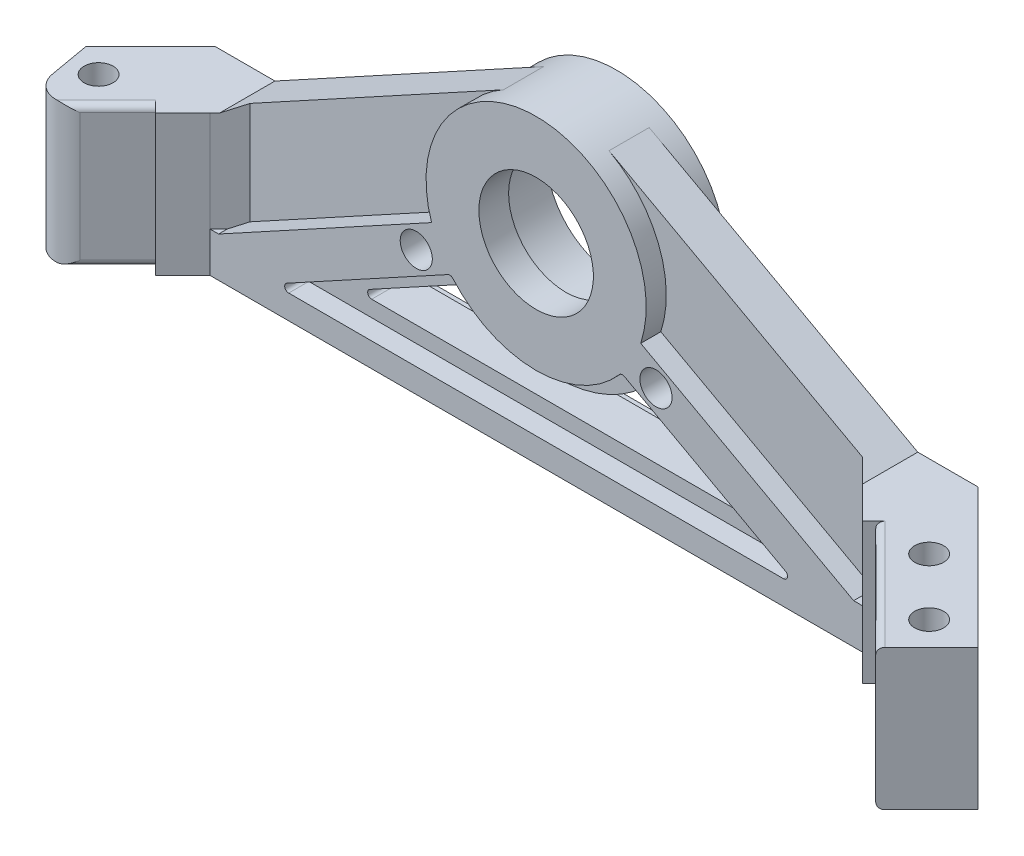
from build123d import *

# Parameters (mm, degrees)
BOSS_EXTRUDE1_DEPTH     = 11.1125
BOSS_EXTRUDE2_DEPTH     = 12.7
CUT_EXTRUDE2_DEPTH      = 8
CUT_EXTRUDE3_DEPTH      = 96.942967533
SKETCH5_W               = 25.144717139
SKETCH5_H               = 15.875
CUT_EXTRUDE4_DEPTH      = 3.175
CUT_EXTRUDE5_DEPTH      = 96.942967533
SKETCH6_R               = 2.54
CUT_EXTRUDE6_DEPTH      = 96.942967533
CUT_EXTRUDE7_START      = -3.175
CUT_EXTRUDE7_DEPTH      = 3.175
CHAMFER1_SIZE           = 3.175
FILLET1_R               = 0.635
FILLET3_R               = 1.016
SKETCH8_R               = 2.286
CUT_EXTRUDE8_DEPTH      = 93.295392221
CUT_EXTRUDE9_DEPTH      = 93.295392221
CUT_EXTRUDE9_DEPTH_BACK = 93.295392221
FILLET4_R               = 3.81
CUT_EXTRUDE10_DEPTH     = 0.5


# Some blends are built 0.0001 mm under size
with BuildPart() as part:
    # Sketch3 → Boss-Extrude1 (new, symmetric)
    with BuildSketch(Plane(origin=(0, 0, 0), x_dir=(1, 0, 0), z_dir=(0, 1, 0))):
        Polygon((-56.934473853, -15.948934871), (-65.016704362, -7.866704362), (-82.294717139, -25.144717139), (-74.93090712, -32.508527158), (-74.21248663, -33.226947648), align=None)
        Polygon((-65.016704362, -7.866704362), (-55.873813681, -17.009595043), (-52.371513794, -13.507295156), (-61.514404475, -4.364404475), align=None)
        Polygon((-52.371513794, -13.507295156), (-51.564218639, -12.7), (-17.311249955, -12.7), (0, -12.7), (0, 0), (-17.311249955, 0), (-57.15, 0), (-60.325, -3.175), (-61.514404475, -4.364404475), align=None)
        Polygon((0, 0), (0, -12.7), (17.311249955, -12.7), (51.564218639, -12.7), (52.371513794, -13.507295156), (61.514404475, -4.364404475), (60.325, -3.175), (57.15, 0), (17.311249955, 0), align=None)
        Polygon((61.514404475, -4.364404475), (65.016704362, -7.866704362), (55.873813681, -17.009595043), (52.371513794, -13.507295156), align=None)
        Polygon((65.016704362, -7.866704362), (56.934473853, -15.948934871), (74.21248663, -33.226947648), (74.93090712, -32.508527158), (82.294717139, -25.144717139), align=None)
    extrude(amount=BOSS_EXTRUDE1_DEPTH, both=True)

    # Sketch2 → Boss-Extrude2 (add)
    with BuildSketch(Plane.XY):
        with BuildLine():
            Line((-50.804788276, 11.1125), (50.804788276, 11.1125))
            Line((50.804788276, 11.1125), (8.344749207, 34.318436746))
            ThreePointArc((8.344749207, 34.318436746), (0, 36.45), (-8.344749207, 34.318436746))
            Line((-8.344749207, 34.318436746), (-50.804788276, 11.1125))
        make_face()
    extrude(amount=BOSS_EXTRUDE2_DEPTH)

    # Sketch2<3> → Cut-Extrude2 (cut)
    with BuildSketch(Plane.XY):
        with BuildLine():
            ThreePointArc((0, 30.1), (-11.05, 19.05), (0, 8))
            Line((0, 8), (0, 10))
            ThreePointArc((0, 10), (-9.05, 19.05), (0, 28.1))
            Line((0, 28.1), (0, 30.1))
        make_face()
        with BuildLine():
            Line((0, 10), (0, 8))
            ThreePointArc((0, 8), (7.813529932, 11.236470068), (11.05, 19.05))
            ThreePointArc((11.05, 19.05), (7.813529932, 26.863529932), (0, 30.1))
            Line((0, 30.1), (0, 28.1))
            ThreePointArc((0, 28.1), (6.39931637, 25.44931637), (9.05, 19.05))
            ThreePointArc((9.05, 19.05), (6.39931637, 12.65068363), (0, 10))
        make_face()
        with BuildLine():
            ThreePointArc((0, 28.1), (-9.05, 19.05), (0, 10))
            Line((0, 10), (0, 28.1))
        make_face()
        with BuildLine():
            Line((0, 28.1), (0, 10))
            ThreePointArc((0, 10), (6.39931637, 12.65068363), (9.05, 19.05))
            ThreePointArc((9.05, 19.05), (6.39931637, 25.44931637), (0, 28.1))
        make_face()
    extrude(amount=CUT_EXTRUDE2_DEPTH, mode=Mode.SUBTRACT)

    # Sketch2<5> → Cut-Extrude3 (cut, through all)
    with BuildSketch(Plane.XY):
        with BuildLine():
            ThreePointArc((0, 28.1), (-9.05, 19.05), (0, 10))
            Line((0, 10), (0, 28.1))
        make_face()
        with BuildLine():
            Line((0, 28.1), (0, 10))
            ThreePointArc((0, 10), (6.39931637, 12.65068363), (9.05, 19.05))
            ThreePointArc((9.05, 19.05), (6.39931637, 25.44931637), (0, 28.1))
        make_face()
    extrude(amount=CUT_EXTRUDE3_DEPTH, mode=Mode.SUBTRACT)

    # Sketch5 → Cut-Extrude4 (cut)
    # profile 1 of 5: a face of its own
    with BuildSketch(Plane(origin=(0, 0, 0), x_dir=(-1, 0, 0), z_dir=(0, 0, -1))):
        with Locations((-69.72235857, 3.175)):
            Rectangle(SKETCH5_W, SKETCH5_H)
    # profile 2 of 5: a face of its own
    with BuildSketch(Plane(origin=(0, 0, 0), x_dir=(-1, 0, 0), z_dir=(0, 0, -1))):
        with BuildLine():
            Line((-50.190202202, -4.7625), (-16.534774751, 13.631400187))
            ThreePointArc((-16.534774751, 13.631400187), (-16.178258512, 25.454994263), (-8.344749207, 34.318436746))
            Line((-8.344749207, 34.318436746), (-50.804788276, 11.1125))
            Line((-50.804788276, 11.1125), (-57.15, 11.1125))
            Line((-57.15, 11.1125), (-57.15, -4.7625))
            Line((-57.15, -4.7625), (-50.190202202, -4.7625))
        make_face()
    # profile 3 of 5: a face of its own
    with BuildSketch(Plane(origin=(0, 0, 0), x_dir=(-1, 0, 0), z_dir=(0, 0, -1))):
        with BuildLine():
            Line((50.804788276, 11.1125), (8.344749207, 34.318436746))
            ThreePointArc((8.344749207, 34.318436746), (14.965938597, 27.925848236), (17.4, 19.05))
            ThreePointArc((17.4, 19.05), (17.182332215, 16.306378367), (16.534774751, 13.631400187))
            Line((16.534774751, 13.631400187), (50.190202202, -4.7625))
            Line((50.190202202, -4.7625), (57.15, -4.7625))
            Line((57.15, -4.7625), (57.15, 11.1125))
            Line((57.15, 11.1125), (50.804788276, 11.1125))
        make_face()
    # profile 4 of 5: a face of its own
    with BuildSketch(Plane(origin=(0, 0, 0), x_dir=(-1, 0, 0), z_dir=(0, 0, -1))):
        with Locations((69.72235857, 3.175)):
            Rectangle(SKETCH5_W, SKETCH5_H)
    # profile 5 of 5: a face of its own
    with BuildSketch(Plane(origin=(0, 0, 0), x_dir=(-1, 0, 0), z_dir=(0, 0, -1))):
        with BuildLine():
            ThreePointArc((13.489420874, 8.059298271), (0, 1.65), (-13.489420874, 8.059298271))
            Line((-13.489420874, 8.059298271), (-41.5969936, -7.3025))
            Line((-41.5969936, -7.3025), (41.5969936, -7.3025))
            Line((41.5969936, -7.3025), (13.489420874, 8.059298271))
        make_face()
        with BuildLine():
            Line((31.653276027, -4.7625), (-31.653276027, -4.7625))
            Line((-31.653276027, -4.7625), (-14.022402602, 4.873405723))
            ThreePointArc((-14.022402602, 4.873405723), (0, -0.89), (14.022402602, 4.873405723))
            Line((14.022402602, 4.873405723), (31.653276027, -4.7625))
        make_face(mode=Mode.SUBTRACT)
    extrude(amount=-CUT_EXTRUDE4_DEPTH, mode=Mode.SUBTRACT)

    # Sketch5<3> → Cut-Extrude5 (cut, through all)
    with BuildSketch(Plane(origin=(0, 0, 0), x_dir=(-1, 0, 0), z_dir=(0, 0, -1))):
        with BuildLine():
            ThreePointArc((-14.022402602, 4.873405723), (0, -0.89), (14.022402602, 4.873405723))
            Line((14.022402602, 4.873405723), (31.653276027, -4.7625))
            Line((31.653276027, -4.7625), (-31.653276027, -4.7625))
            Line((-31.653276027, -4.7625), (-14.022402602, 4.873405723))
        make_face()
    extrude(amount=-CUT_EXTRUDE5_DEPTH, mode=Mode.SUBTRACT)

    # Sketch6 → Cut-Extrude6 (cut, through all)
    with BuildSketch(Plane(origin=(0, 0, 0), x_dir=(-1, 0, 0), z_dir=(0, 0, -1))):
        with Locations((-18.945146514, 8.695796817)):
            Circle(SKETCH6_R)
        with Locations((18.945146514, 8.695796817)):
            Circle(SKETCH6_R)
    extrude(amount=-CUT_EXTRUDE6_DEPTH, mode=Mode.SUBTRACT)

    # Sketch7 → Cut-Extrude7 (cut)
    # profile 1 of 3: a face of its own
    with BuildSketch(Plane.XY.offset(12.7).offset(CUT_EXTRUDE7_START)):
        with BuildLine():
            ThreePointArc((13.489420874, 8.059298271), (0, 1.65), (-13.489420874, 8.059298271))
            Line((-13.489420874, 8.059298271), (-41.5969936, -7.3025))
            Line((-41.5969936, -7.3025), (41.5969936, -7.3025))
            Line((41.5969936, -7.3025), (13.489420874, 8.059298271))
        make_face()
        with BuildLine():
            Line((-31.653276027, -4.7625), (-14.022402602, 4.873405723))
            ThreePointArc((-14.022402602, 4.873405723), (0, -0.89), (14.022402602, 4.873405723))
            Line((14.022402602, 4.873405723), (31.653276027, -4.7625))
            Line((31.653276027, -4.7625), (-31.653276027, -4.7625))
        make_face(mode=Mode.SUBTRACT)
    # profile 2 of 3: a face of its own
    with BuildSketch(Plane.XY.offset(12.7).offset(CUT_EXTRUDE7_START)):
        with BuildLine():
            Line((-51.564218639, -4.7625), (-50.190202202, -4.7625))
            Line((-50.190202202, -4.7625), (-16.534774751, 13.631400187))
            ThreePointArc((-16.534774751, 13.631400187), (-16.178258512, 25.454994263), (-8.344749207, 34.318436746))
            Line((-8.344749207, 34.318436746), (-50.804788276, 11.1125))
            Line((-50.804788276, 11.1125), (-51.564218639, 11.1125))
            Line((-51.564218639, 11.1125), (-51.564218639, -4.7625))
        make_face()
    # profile 3 of 3: a face of its own
    with BuildSketch(Plane.XY.offset(12.7).offset(CUT_EXTRUDE7_START)):
        with BuildLine():
            Line((50.804788276, 11.1125), (8.344749207, 34.318436746))
            ThreePointArc((8.344749207, 34.318436746), (14.965938597, 27.925848236), (17.4, 19.05))
            ThreePointArc((17.4, 19.05), (17.182332215, 16.306378367), (16.534774751, 13.631400187))
            Line((16.534774751, 13.631400187), (50.190202202, -4.7625))
            Line((50.190202202, -4.7625), (51.564218639, -4.7625))
            Line((51.564218639, -4.7625), (51.564218639, 11.1125))
            Line((51.564218639, 11.1125), (50.804788276, 11.1125))
        make_face()
    extrude(amount=CUT_EXTRUDE7_DEPTH, mode=Mode.SUBTRACT)

    # Chamfer1
    chamfer1_edges = [part.edges().sort_by_distance(p)[0] for p in [
        (51.564218639, 3.175, 9.525),
        (-51.564218639, 3.175, 9.525),
    ]]
    chamfer(chamfer1_edges, length=CHAMFER1_SIZE - 0.0001)  # a hair under: the kernel refuses the full size

    # Fillet1
    fillet1_edges = [part.edges().sort_by_distance(p)[0] for p in [
        (13.489420874, 8.059298271, 1.5875),
        (-13.489420874, 8.059298271, 1.5875),
        (-41.5969936, -7.3025, 1.5875),
        (41.5969936, -7.3025, 1.5875),
        (14.022402602, 4.873405723, 6.35),
        (31.653276027, -4.7625, 6.35),
        (-31.653276027, -4.7625, 6.35),
        (-14.022402602, 4.873405723, 6.35),
        (-13.489420874, 8.059298271, 11.1125),
        (13.489420874, 8.059298271, 11.1125),
        (41.5969936, -7.3025, 11.1125),
        (-41.5969936, -7.3025, 11.1125),
    ]]
    fillet(fillet1_edges, radius=FILLET1_R)

    # Fillet3
    fillet3_edges = [part.edges().sort_by_distance(p)[0] for p in [
        (65.573480242, -11.1125, 24.587941259),
        (-65.573480242, -11.1125, 24.587941259),
        (65.573480242, 11.1125, 24.587941259),
        (-65.573480242, 11.1125, 24.587941259),
    ]]
    fillet(fillet3_edges, radius=FILLET3_R)

    # Sketch8 → Cut-Extrude8 (cut, through all)
    with BuildSketch(Plane(origin=(0, 11.1125, 0), x_dir=(1, 0, 0), z_dir=(0, 1, 0))):
        with Locations(Location((74.625578412, -25.198598676, 0), (0, 0, 270))):
            Circle(SKETCH8_R)
        with Locations(Location((-74.625578412, -25.198598676, 0), (0, 0, 270))):
            Circle(SKETCH8_R)
        with Locations(Location((65.645322291, -16.218342555, 0), (0, 0, 270))):
            Circle(SKETCH8_R)
        with Locations(Location((-65.645322291, -16.218342555, 0), (0, 0, 90))):
            Circle(SKETCH8_R)
    extrude(amount=-CUT_EXTRUDE8_DEPTH, mode=Mode.SUBTRACT)

    # Sketch9 → Cut-Extrude9 (cut, two sides: drawn at the far end of the back side and taken through both)
    with BuildSketch(Plane(origin=(0, 11.1125, 0), x_dir=(1, 0, 0), z_dir=(0, 1, 0)).offset(-CUT_EXTRUDE9_DEPTH_BACK)):
        Polygon((-87.387144721, -37.100830404), (-87.387144721, -13.335), (-70.485, -13.335), (-68.277385266, -25.855005305), (-66.294442881, -37.100830404), align=None)
    extrude(amount=CUT_EXTRUDE9_DEPTH + CUT_EXTRUDE9_DEPTH_BACK, mode=Mode.SUBTRACT)

    # Fillet4
    # the kernel refuses this fillet: 3.81 mm, written as the material it takes off along each edge
    with BuildSketch(Plane(origin=(-68.062008219, -28.393854759, 27.076469237), x_dir=(-0.17364817766692658, 0, -0.9848077530122087), z_dir=(0, 1, 0))) as fillet4_piece_1:
        with BuildLine():
            CenterArc((FILLET4_R * 1.92098212697, -FILLET4_R), FILLET4_R, 90, 125)
            Line((FILLET4_R * 1.10183008268, -FILLET4_R * 1.57357643635), (0, 0))
            Line((0, 0), (FILLET4_R * 1.92098212697, 0))
        make_face()
    extrude(amount=56.787709519, mode=Mode.SUBTRACT)

    # Sketch11 → Cut-Extrude10 (cut)
    # profile 1 of 5: a face of its own
    with BuildSketch(Plane.XZ.offset(11.1125)):
        with BuildLine():
            Line((6.955128205, 5.655889423), (6.573717949, 5.452564103))
            add(Edge.make_bspline(
                [(6.573717949, 5.452564103), (6.545922437, 5.498605223), (6.492797515, 5.586602559), (6.405563696, 5.705145418), (6.318829653, 5.806231322), (6.231739217, 5.889758205), (6.143082637, 5.95438438), (6.053764997, 6.001091066), (5.963227276, 6.030447771), (5.9020118, 6.034100411), (5.871895032, 6.035897436)],
                knots=[0, 0, 0, 0, 1.354943589, 2.589672558, 3.704607527, 4.708856974, 5.624398268, 6.459549776, 7.242129862, 8, 8, 8, 8], degree=3))
            add(Edge.make_bspline(
                [(5.871895032, 6.035897436), (5.843777409, 6.034998249), (5.788084486, 6.03321722), (5.706289617, 6.017626176), (5.626860085, 5.99419681), (5.551935483, 5.959511514), (5.48244247, 5.918382044), (5.420674582, 5.869797955), (5.368082166, 5.814645054), (5.325239521, 5.753088186), (5.291507213, 5.688001962), (5.267412618, 5.620080583), (5.252956595, 5.549928839), (5.250989532, 5.502409986), (5.25, 5.478505609)],
                knots=[0, 0, 0, 0, 1.088711937, 2.156425153, 3.216543554, 4.290691142, 5.346933412, 6.339926723, 7.326538423, 8.288906172, 9.236802047, 10.159214894, 11.073992371, 12, 12, 12, 12], degree=3))
            add(Edge.make_bspline(
                [(5.25, 5.478505609), (5.251289441, 5.451237129), (5.253897944, 5.396073728), (5.277544855, 5.314729095), (5.312451573, 5.233254329), (5.346112616, 5.182849411), (5.363581731, 5.156690705)],
                knots=[0, 0, 0, 0, 0.942144539, 1.905933023, 2.913239343, 4, 4, 4, 4], degree=3))
            add(Edge.make_bspline(
                [(5.363581731, 5.156690705), (5.378599068, 5.137617448), (5.410211837, 5.097466622), (5.463771743, 5.037071303), (5.526108213, 4.973940726), (5.598480894, 4.909395911), (5.677065406, 4.839348386), (5.765885722, 4.768357575), (5.862751255, 4.693916401), (5.930689868, 4.644038805), (5.965845353, 4.618229167)],
                knots=[0, 0, 0, 0, 0.718605451, 1.5127255, 2.388525841, 3.34361075, 4.383114545, 5.504804886, 6.708837455, 8, 8, 8, 8], degree=3))
            add(Edge.make_bspline(
                [(5.965845353, 4.618229167), (6.00168954, 4.592171602), (6.070464497, 4.542174431), (6.167362407, 4.468878347), (6.254240814, 4.401295296), (6.3304335, 4.339372455), (6.395949126, 4.282571618), (6.450649678, 4.231125865), (6.496181868, 4.186447001), (6.520649569, 4.156384964), (6.531650641, 4.14286859)],
                knots=[0, 0, 0, 0, 1.435833971, 2.754963323, 3.936484598, 5.002077172, 5.935979083, 6.744956812, 7.435712417, 8, 8, 8, 8], degree=3))
            add(Edge.make_bspline(
                [(6.531650641, 4.14286859), (6.547710719, 4.122117406), (6.579262034, 4.081350037), (6.61920709, 4.015956536), (6.653578917, 3.949707187), (6.681889214, 3.881988561), (6.703827988, 3.813016997), (6.718920828, 3.742550617), (6.729567054, 3.670869327), (6.730367062, 3.622441786), (6.730769231, 3.598096955)],
                knots=[0, 0, 0, 0, 1.064105702, 2.090521257, 3.104283852, 4.09061442, 5.065433238, 6.036507983, 7.012940167, 8, 8, 8, 8], degree=3))
            add(Edge.make_bspline(
                [(6.730769231, 3.598096955), (6.729515083, 3.560126606), (6.727031963, 3.484948093), (6.704399939, 3.375068313), (6.668607851, 3.26994227), (6.617838539, 3.171328353), (6.554959306, 3.080088965), (6.479870762, 2.998403207), (6.392434284, 2.927813249), (6.294689139, 2.868139824), (6.189328785, 2.819749269), (6.078360338, 2.785257467), (5.963128198, 2.764347606), (5.884835503, 2.761630248), (5.845252404, 2.76025641)],
                knots=[0, 0, 0, 0, 1.004538361, 1.98891246, 2.957754601, 3.937604432, 4.916182936, 5.884154884, 6.865254872, 7.882148152, 8.909646262, 9.927556077, 10.952217026, 12, 12, 12, 12], degree=3))
            add(Edge.make_bspline(
                [(5.845252404, 2.76025641), (5.800288489, 2.761765646), (5.711198198, 2.764756006), (5.58029896, 2.787799883), (5.45446477, 2.825234465), (5.353568286, 2.868466228), (5.275055104, 2.912290321), (5.215686682, 2.951924562), (5.154833361, 2.996764375), (5.09442727, 3.049062555), (5.032112714, 3.106283691), (4.9710811, 3.171539686), (4.907469941, 3.241090211), (4.86692652, 3.291248304), (4.846153846, 3.316947115)],
                knots=[0, 0, 0, 0, 1.360687177, 2.696028959, 4.010076158, 5.328383209, 6.009416266, 6.72960499, 7.488083515, 8.296188009, 9.147227534, 10.04798982, 10.999875445, 12, 12, 12, 12], degree=3))
            Line((4.846153846, 3.316947115), (5.212139423, 3.567948718))
            add(Edge.make_bspline(
                [(5.212139423, 3.567948718), (5.231197788, 3.547515179), (5.267953877, 3.508106922), (5.322642771, 3.45291865), (5.373784064, 3.403079657), (5.421450494, 3.358595495), (5.466336542, 3.319984295), (5.508000192, 3.286910753), (5.546973362, 3.260282729), (5.593160244, 3.230943128), (5.651920246, 3.204105222), (5.723895671, 3.180794058), (5.798937681, 3.16714817), (5.849638961, 3.165128681), (5.875400641, 3.164102564)],
                knots=[0, 0, 0, 0, 1.253255604, 2.417037033, 3.484535688, 4.456276324, 5.340879413, 6.139846054, 6.840628373, 7.457335203, 8.592193832, 9.725986821, 10.844557802, 12, 12, 12, 12], degree=3))
            add(Edge.make_bspline(
                [(5.875400641, 3.164102564), (5.902885124, 3.165396572), (5.956317203, 3.167912228), (6.032932005, 3.189110321), (6.103119698, 3.223200893), (6.165194449, 3.27097975), (6.217718177, 3.329639699), (6.255574284, 3.399162998), (6.277829561, 3.478036176), (6.280604327, 3.533445496), (6.282051282, 3.562339744)],
                knots=[0, 0, 0, 0, 1.033786987, 2.00976631, 2.970458119, 3.95651055, 4.942051941, 5.915168215, 6.91282465, 8, 8, 8, 8], degree=3))
            add(Edge.make_bspline(
                [(6.282051282, 3.562339744), (6.28149088, 3.581062134), (6.28037143, 3.618461629), (6.272009308, 3.67382967), (6.256922644, 3.72753238), (6.23645815, 3.780017787), (6.209395004, 3.831703254), (6.175597302, 3.882906129), (6.134357789, 3.933943781), (6.102846717, 3.966210779), (6.086438301, 3.983012821)],
                knots=[0, 0, 0, 0, 0.941102048, 1.879927795, 2.806320176, 3.740133313, 4.70706341, 5.733547381, 6.819814909, 8, 8, 8, 8], degree=3))
            add(Edge.make_bspline(
                [(6.086438301, 3.983012821), (6.078121626, 3.990836739), (6.059033112, 4.008794272), (6.024022728, 4.036292581), (5.981368032, 4.070768116), (5.930477678, 4.111658174), (5.869678278, 4.156742774), (5.801217798, 4.209033937), (5.723362816, 4.266177574), (5.668576046, 4.306239142), (5.639823718, 4.327263622)],
                knots=[0, 0, 0, 0, 0.485581606, 1.114511607, 1.892484918, 2.819534315, 3.891398566, 5.11240712, 6.484579029, 8, 8, 8, 8], degree=3))
            add(Edge.make_bspline(
                [(5.639823718, 4.327263622), (5.600647247, 4.355810699), (5.524859001, 4.411036014), (5.417274927, 4.494420765), (5.320111394, 4.575739513), (5.231859623, 4.653699656), (5.153297125, 4.728862304), (5.085159515, 4.802258672), (5.025718972, 4.871778844), (4.962356185, 4.960505052), (4.898616052, 5.06962878), (4.843298524, 5.202280536), (4.808089766, 5.335069751), (4.80353079, 5.424082684), (4.801282051, 5.467988782)],
                knots=[0, 0, 0, 0, 1.186639563, 2.29559556, 3.331401308, 4.287832086, 5.178002532, 5.991653193, 6.738845359, 7.415240842, 8.658551622, 9.823054859, 10.926210341, 12, 12, 12, 12], degree=3))
            add(Edge.make_bspline(
                [(4.801282051, 5.467988782), (4.802275506, 5.499122385), (4.804250073, 5.561002801), (4.818566607, 5.652496737), (4.842387021, 5.741426577), (4.876660762, 5.827412615), (4.919396348, 5.91127786), (4.972439298, 5.992227342), (5.035257903, 6.070059394), (5.106262482, 6.144446648), (5.183899032, 6.213576047), (5.267788427, 6.274099775), (5.356348148, 6.325831589), (5.450294329, 6.366808857), (5.548106527, 6.400426022), (5.651087312, 6.423387681), (5.758665045, 6.436656939), (5.831894176, 6.438703864), (5.869090545, 6.43974359)],
                knots=[0, 0, 0, 0, 0.932738639, 1.853889356, 2.767877299, 3.686041414, 4.622558463, 5.584089528, 6.580490983, 7.61578374, 8.662665956, 9.690923261, 10.710750907, 11.729736566, 12.757349726, 13.805636525, 14.885384091, 16, 16, 16, 16], degree=3))
            add(Edge.make_bspline(
                [(5.869090545, 6.43974359), (5.896214412, 6.439141134), (5.949637214, 6.437954545), (6.028947511, 6.430427802), (6.106126309, 6.415961477), (6.181596753, 6.397257975), (6.255405946, 6.373441591), (6.326602693, 6.34297607), (6.396372582, 6.307982208), (6.464315382, 6.267008021), (6.530517733, 6.219030474), (6.595355852, 6.163337979), (6.658453112, 6.09895153), (6.720891134, 6.026707642), (6.781845028, 5.945793723), (6.841172492, 5.856635242), (6.899631031, 5.759519711), (6.936264526, 5.691113712), (6.955128205, 5.655889423)],
                knots=[0, 0, 0, 0, 0.916943493, 1.805999526, 2.689245248, 3.568702553, 4.433092864, 5.307568578, 6.183755457, 7.069823058, 7.986358083, 8.944343836, 9.955449961, 11.030835633, 12.170024038, 13.377301724, 14.649494474, 16, 16, 16, 16], degree=3))
        make_face()
    # profile 2 of 5: a face of its own
    with BuildSketch(Plane.XZ.offset(11.1125)):
        Polygon((4.128205128, 6.35), (4.128205128, 2.85), (3.962039263, 2.85), (1.83974359, 5.509354968), (1.83974359, 2.85), (1.391025641, 2.85), (1.391025641, 6.35), (1.574719551, 6.35), (3.679487179, 3.69765625), (3.679487179, 6.35), align=None)
    # profile 3 of 5: a face of its own
    with BuildSketch(Plane.XZ.offset(11.1125)):
        Polygon((0.043469551, 2.85), (-0.717948718, 2.85), (-0.717948718, 6.35), (-0.269230769, 6.35), (-0.269230769, 3.253846154), (0.269230769, 3.253846154), align=None)
    # profile 4 of 5: a face of its own
    with BuildSketch(Plane.XZ.offset(11.1125)):
        with BuildLine():
            add(Edge.make_bspline(
                [(-1.929487179, 4.601402244), (-1.929820024, 4.545772786), (-1.930466421, 4.437738209), (-1.937473576, 4.280579568), (-1.949475503, 4.133047998), (-1.965186437, 3.99497525), (-1.985981936, 3.866455085), (-2.01210377, 3.747657913), (-2.041666608, 3.638070524), (-2.077057072, 3.537721733), (-2.116884293, 3.445335588), (-2.159279173, 3.358445926), (-2.207248145, 3.277982304), (-2.258445983, 3.202763868), (-2.313138476, 3.132633266), (-2.372968524, 3.069102006), (-2.436199286, 3.01043296), (-2.503346552, 2.957979374), (-2.573759685, 2.911897493), (-2.645716894, 2.870677498), (-2.720506077, 2.837466064), (-2.796608784, 2.808773511), (-2.875043288, 2.787234356), (-2.955710335, 2.771953379), (-3.038153153, 2.761483068), (-3.094018037, 2.760666707), (-3.122095353, 2.76025641)],
                knots=[0, 0, 0, 0, 1.622605109, 3.151162473, 4.587442309, 5.939538287, 7.20372481, 8.383107478, 9.486239959, 10.512528934, 11.483748244, 12.419707751, 13.330476935, 14.213498841, 15.072700274, 15.92158999, 16.756207925, 17.586695167, 18.403499641, 19.2093348, 20.002585959, 20.787710657, 21.579935901, 22.371427536, 23.181490415, 24, 24, 24, 24], degree=3))
            add(Edge.make_bspline(
                [(-3.122095353, 2.76025641), (-3.152731517, 2.761033674), (-3.213201864, 2.762567854), (-3.302787896, 2.771651823), (-3.389864801, 2.78757717), (-3.474185977, 2.81134458), (-3.556619955, 2.83954235), (-3.63604835, 2.875891171), (-3.713266346, 2.917848905), (-3.787678328, 2.966252878), (-3.858415308, 3.020964068), (-3.925441203, 3.081687718), (-3.988267508, 3.148014653), (-4.046907915, 3.220326578), (-4.101416121, 3.2977732), (-4.151425746, 3.381374377), (-4.197578861, 3.470324753), (-4.240034798, 3.565409639), (-4.277149587, 3.667580194), (-4.309407109, 3.777408534), (-4.336484753, 3.895211611), (-4.358892888, 4.021105793), (-4.376144672, 4.154950988), (-4.388881636, 4.296670021), (-4.395532446, 4.44639057), (-4.396790125, 4.548812409), (-4.397435897, 4.601402244)],
                knots=[0, 0, 0, 0, 0.874832558, 1.726764085, 2.568361456, 3.398879789, 4.226201588, 5.053523386, 5.889679481, 6.733707388, 7.585299078, 8.4404393, 9.313717912, 10.191269597, 11.096596538, 12.015593249, 12.970707924, 13.956566593, 14.986800884, 16.072143337, 17.223061702, 18.436511454, 19.721974523, 21.075312687, 22.498281019, 24, 24, 24, 24], degree=3))
            add(Edge.make_bspline(
                [(-4.397435897, 4.601402244), (-4.396782502, 4.653757336), (-4.395510127, 4.755709971), (-4.388966535, 4.904744814), (-4.375857992, 5.045682145), (-4.359906802, 5.178975556), (-4.336868841, 5.303968911), (-4.311081981, 5.421313071), (-4.278377775, 5.530191748), (-4.241956283, 5.631910666), (-4.200730937, 5.726917543), (-4.153785212, 5.815343618), (-4.104592007, 5.899021968), (-4.050060208, 5.976726285), (-3.991471708, 6.048656628), (-3.928478795, 6.115269439), (-3.861485674, 6.17603404), (-3.790212069, 6.231128369), (-3.715479627, 6.279794991), (-3.638364874, 6.322876937), (-3.558372006, 6.358984162), (-3.47592898, 6.388001652), (-3.391043214, 6.411839285), (-3.303435357, 6.427402676), (-3.213482705, 6.437646554), (-3.152739512, 6.439040408), (-3.122095353, 6.43974359)],
                knots=[0, 0, 0, 0, 1.49659969, 2.914373258, 4.262463443, 5.541784011, 6.749918813, 7.89402581, 8.97408983, 9.996834451, 10.981022981, 11.93120719, 12.856888794, 13.753851156, 14.64171265, 15.506454614, 16.371918745, 17.224394982, 18.078544691, 18.918788586, 19.746969722, 20.583674387, 21.415055378, 22.264095942, 23.124258755, 24, 24, 24, 24], degree=3))
            add(Edge.make_bspline(
                [(-3.122095353, 6.43974359), (-3.09379246, 6.439262863), (-3.037736562, 6.438310748), (-2.954962623, 6.428966204), (-2.874322736, 6.413472536), (-2.796083047, 6.391704526), (-2.719785436, 6.364330767), (-2.645951414, 6.33048748), (-2.574212715, 6.290386167), (-2.504974112, 6.244015703), (-2.438313207, 6.192389521), (-2.375492482, 6.134420479), (-2.316719786, 6.07040235), (-2.26121611, 6.000976337), (-2.209744799, 5.925591128), (-2.163065245, 5.843940476), (-2.119409324, 5.756680398), (-2.07933584, 5.66314306), (-2.043193198, 5.562154409), (-2.012518016, 5.452245215), (-1.986781079, 5.333047342), (-1.966139854, 5.20450334), (-1.949205111, 5.067012571), (-1.937551448, 4.920113235), (-1.930454678, 4.763900402), (-1.929815614, 4.656565118), (-1.929487179, 4.601402244)],
                knots=[0, 0, 0, 0, 0.826227461, 1.636402404, 2.428761462, 3.221854935, 4.005495932, 4.793404576, 5.590831925, 6.402844393, 7.224663165, 8.050552332, 8.895728592, 9.760111832, 10.644101474, 11.558317463, 12.504453911, 13.491971134, 14.528097073, 15.634271589, 16.821614375, 18.087186367, 19.434798266, 20.865849934, 22.389264722, 24, 24, 24, 24], degree=3))
        make_face()
        with BuildLine():
            add(Edge.make_bspline(
                [(-2.378205128, 4.6), (-2.378419726, 4.646978143), (-2.378835172, 4.737924313), (-2.383553365, 4.869584142), (-2.392507878, 4.992010362), (-2.402014458, 5.10560144), (-2.417187446, 5.210052574), (-2.43417632, 5.305659219), (-2.455212435, 5.392009987), (-2.479161501, 5.469956862), (-2.506024847, 5.540860229), (-2.535825564, 5.606139939), (-2.566716304, 5.667314607), (-2.601696035, 5.722840453), (-2.637826639, 5.774385586), (-2.677248131, 5.820847469), (-2.719335124, 5.862303347), (-2.777555397, 5.909959052), (-2.852043249, 5.959857009), (-2.944753063, 6.00300953), (-3.038190548, 6.031176958), (-3.101340061, 6.03433403), (-3.132612179, 6.035897436)],
                knots=[0, 0, 0, 0, 1.565050911, 3.029821469, 4.387792543, 5.654509782, 6.826079957, 7.902709307, 8.888453275, 9.784884885, 10.617798265, 11.412307314, 12.174931846, 12.898730956, 13.596561216, 14.270483471, 14.92565982, 15.561680851, 16.775288496, 17.900403612, 18.96026391, 20, 20, 20, 20], degree=3))
            add(Edge.make_bspline(
                [(-3.132612179, 6.035897436), (-3.168054227, 6.034058471), (-3.238491124, 6.030403744), (-3.34261479, 6.00330136), (-3.442241405, 5.957590126), (-3.521609932, 5.906501163), (-3.581382078, 5.856874548), (-3.624246304, 5.8146102), (-3.66449279, 5.768073914), (-3.701752084, 5.716682081), (-3.735741366, 5.660292891), (-3.768453883, 5.600087809), (-3.796952303, 5.534691513), (-3.813420097, 5.489117655), (-3.821814904, 5.465885417)],
                knots=[0, 0, 0, 0, 1.332284016, 2.647757677, 4.016941371, 5.440902831, 6.183743781, 6.935888695, 7.702483601, 8.495487208, 9.320161261, 10.177499591, 11.070941831, 12, 12, 12, 12], degree=3))
            add(Edge.make_bspline(
                [(-3.821814904, 5.465885417), (-3.831929041, 5.435361862), (-3.85254741, 5.373137481), (-3.878379392, 5.276258244), (-3.899765093, 5.174602806), (-3.918179373, 5.068712538), (-3.932161364, 4.95805397), (-3.941825857, 4.842733688), (-3.947369549, 4.722750985), (-3.948263486, 4.641371816), (-3.948717949, 4.6)],
                knots=[0, 0, 0, 0, 0.877617242, 1.789083553, 2.735016418, 3.71249782, 4.722174671, 5.778575778, 6.870664861, 8, 8, 8, 8], degree=3))
            add(Edge.make_bspline(
                [(-3.948717949, 4.6), (-3.948608725, 4.558624069), (-3.948395719, 4.477934078), (-3.94209743, 4.359902323), (-3.934450595, 4.247559434), (-3.921345323, 4.141010587), (-3.906323118, 4.040122019), (-3.88762759, 3.944993441), (-3.86425341, 3.856240158), (-3.8386314, 3.772957339), (-3.808880154, 3.695983195), (-3.777431111, 3.62396806), (-3.743341134, 3.557627664), (-3.706562256, 3.496727767), (-3.667551009, 3.441112765), (-3.625087361, 3.391371184), (-3.581383507, 3.346161322), (-3.519748428, 3.295331926), (-3.439673756, 3.243599562), (-3.339527163, 3.197463773), (-3.236699524, 3.169660171), (-3.167126865, 3.16594543), (-3.132612179, 3.164102564)],
                knots=[0, 0, 0, 0, 1.352790526, 2.638168002, 3.864385692, 5.034146782, 6.147421261, 7.199576936, 8.202392153, 9.147488116, 10.047345819, 10.899361637, 11.716276266, 12.484327605, 13.224378387, 13.934792477, 14.621120528, 15.277699797, 16.543226194, 17.726613715, 18.872183198, 20, 20, 20, 20], degree=3))
            add(Edge.make_bspline(
                [(-3.132612179, 3.164102564), (-3.101339883, 3.165675934), (-3.037964587, 3.16886447), (-2.94442002, 3.196995009), (-2.851470398, 3.239173971), (-2.777333691, 3.288883), (-2.719393381, 3.336106603), (-2.677871857, 3.377736352), (-2.639393929, 3.424685422), (-2.60210402, 3.475253981), (-2.568451882, 3.531748057), (-2.536289512, 3.592202677), (-2.506803475, 3.657781758), (-2.479852598, 3.728630034), (-2.455862309, 3.806581762), (-2.435063373, 3.893245794), (-2.4167274, 3.988867426), (-2.403286812, 4.093823841), (-2.392094758, 4.207456057), (-2.38369602, 4.330196594), (-2.378797858, 4.46207185), (-2.378407017, 4.55302055), (-2.378205128, 4.6)],
                knots=[0, 0, 0, 0, 1.039553373, 2.106721005, 3.228374519, 4.430983397, 5.066892657, 5.71642622, 6.385219945, 7.087472665, 7.807071781, 8.573169906, 9.367539334, 10.200306343, 11.096580419, 12.082151159, 13.167672988, 14.337976248, 15.605212313, 16.970710972, 18.435224121, 20, 20, 20, 20], degree=3))
        make_face(mode=Mode.SUBTRACT)
    # profile 5 of 5: a face of its own
    with BuildSketch(Plane.XZ.offset(11.1125)):
        with BuildLine():
            Line((-5.245092147, 3.971794872), (-4.801282051, 3.971794872))
            add(Edge.make_bspline(
                [(-4.801282051, 3.971794872), (-4.803366761, 3.926634808), (-4.807444167, 3.838307919), (-4.825549952, 3.709605774), (-4.854880033, 3.588335523), (-4.891900787, 3.473469117), (-4.941285441, 3.366442449), (-4.998265454, 3.265389768), (-5.067053421, 3.172428941), (-5.144787582, 3.087412911), (-5.229170759, 3.010172539), (-5.319883069, 2.943569633), (-5.415391195, 2.886814123), (-5.515713919, 2.840501251), (-5.62104771, 2.804642079), (-5.731092329, 2.778548258), (-5.846198829, 2.762853444), (-5.924664014, 2.76113009), (-5.964443109, 2.76025641)],
                knots=[0, 0, 0, 0, 1.154964179, 2.258951466, 3.315045469, 4.34063582, 5.337653555, 6.322213479, 7.300594401, 8.285733883, 9.262436119, 10.219305053, 11.156568068, 12.097250375, 13.037875795, 13.995471444, 14.983774372, 16, 16, 16, 16], degree=3))
            add(Edge.make_bspline(
                [(-5.964443109, 2.76025641), (-6.006097204, 2.761091724), (-6.087834056, 2.76273084), (-6.206999332, 2.778726766), (-6.319974324, 2.803304136), (-6.425727043, 2.839989752), (-6.526191898, 2.884095411), (-6.619028124, 2.94111554), (-6.705777102, 3.007297216), (-6.785305599, 3.082674358), (-6.855635921, 3.165126813), (-6.919014176, 3.250022045), (-6.971703592, 3.338685262), (-7.014614637, 3.430368523), (-7.048658583, 3.524621782), (-7.072472744, 3.621907553), (-7.086807048, 3.72200102), (-7.088758528, 3.78969025), (-7.08974359, 3.823858173)],
                knots=[0, 0, 0, 0, 1.156557911, 2.26948644, 3.334256095, 4.362881698, 5.374128627, 6.376247308, 7.381327084, 8.400876673, 9.413539857, 10.388755402, 11.340764606, 12.273088208, 13.197214951, 14.119972279, 15.051006438, 16, 16, 16, 16], degree=3))
            add(Edge.make_bspline(
                [(-7.08974359, 3.823858173), (-7.088045107, 3.871674086), (-7.084669824, 3.966695521), (-7.05578825, 4.10679815), (-7.01106145, 4.243123542), (-6.957435967, 4.353631836), (-6.903563974, 4.443103187), (-6.854113634, 4.516974166), (-6.79571664, 4.59683721), (-6.728429281, 4.682734167), (-6.652449625, 4.774844633), (-6.567425493, 4.872665944), (-6.474448088, 4.977386132), (-6.408197141, 5.047945655), (-6.373898237, 5.08447516)],
                knots=[0, 0, 0, 0, 1.155815952, 2.296877386, 3.446591808, 4.620031771, 5.259067201, 5.972606999, 6.769942825, 7.652175971, 8.612158079, 9.658447178, 10.787750223, 12, 12, 12, 12], degree=3))
            Line((-6.373898237, 5.08447516), (-5.512920673, 5.946153846))
            Line((-5.512920673, 5.946153846), (-7.134615385, 5.946153846))
            Line((-7.134615385, 5.946153846), (-7.134615385, 6.35))
            Line((-7.134615385, 6.35), (-4.666666667, 6.35))
            Line((-4.666666667, 6.35), (-6.005809295, 4.871334135))
            add(Edge.make_bspline(
                [(-6.005809295, 4.871334135), (-6.037705826, 4.837316722), (-6.098915852, 4.772036685), (-6.185183845, 4.676477892), (-6.263012936, 4.588132833), (-6.332835286, 4.507075879), (-6.392767637, 4.432183486), (-6.444596108, 4.364663685), (-6.48727331, 4.303766872), (-6.533022085, 4.233134937), (-6.575869546, 4.14687923), (-6.61378961, 4.042874922), (-6.63622893, 3.936286729), (-6.639425955, 3.864623798), (-6.641025641, 3.828766026)],
                knots=[0, 0, 0, 0, 1.341499693, 2.574362431, 3.70333927, 4.728661625, 5.651619014, 6.462468868, 7.176850946, 7.790480236, 8.881937789, 9.938868007, 10.968677379, 12, 12, 12, 12], degree=3))
            add(Edge.make_bspline(
                [(-6.641025641, 3.828766026), (-6.64063291, 3.806519038), (-6.639855811, 3.762498868), (-6.629266831, 3.698035396), (-6.614340591, 3.635514122), (-6.591292177, 3.575917899), (-6.563305951, 3.517979609), (-6.528853434, 3.462454563), (-6.487699593, 3.409611929), (-6.44107595, 3.359592299), (-6.390066601, 3.313480706), (-6.334519552, 3.274590567), (-6.27795616, 3.239110728), (-6.216965807, 3.212394464), (-6.153908297, 3.189872267), (-6.087547234, 3.17615629), (-6.019026006, 3.165134415), (-5.972204604, 3.164451151), (-5.948317308, 3.164102564)],
                knots=[0, 0, 0, 0, 0.998979664, 1.97668359, 2.929689414, 3.883910622, 4.84245991, 5.819147218, 6.815249886, 7.848556019, 8.890320024, 9.899140466, 10.893746026, 11.885851387, 12.885935385, 13.897869393, 14.927537112, 16, 16, 16, 16], degree=3))
            add(Edge.make_bspline(
                [(-5.948317308, 3.164102564), (-5.92561568, 3.16456818), (-5.880955619, 3.165484169), (-5.815182594, 3.174935012), (-5.752048747, 3.19032293), (-5.691340567, 3.211667072), (-5.632620335, 3.238000663), (-5.577316422, 3.272111571), (-5.524553445, 3.311808716), (-5.473523714, 3.356302702), (-5.427325978, 3.408841443), (-5.384774664, 3.467504431), (-5.349317274, 3.534712933), (-5.31763008, 3.607949034), (-5.292108756, 3.688927614), (-5.269832042, 3.776529625), (-5.255234768, 3.871928632), (-5.248536873, 3.937877426), (-5.245092147, 3.971794872)],
                knots=[0, 0, 0, 0, 0.911449231, 1.793059927, 2.662894484, 3.518012734, 4.375035767, 5.2428921, 6.121648788, 7.026059695, 7.956980504, 8.926125838, 9.930158553, 11.002657956, 12.127896548, 13.336997697, 14.630418695, 16, 16, 16, 16], degree=3))
        make_face()
    extrude(amount=-CUT_EXTRUDE10_DEPTH, mode=Mode.SUBTRACT)


solid = part.part
